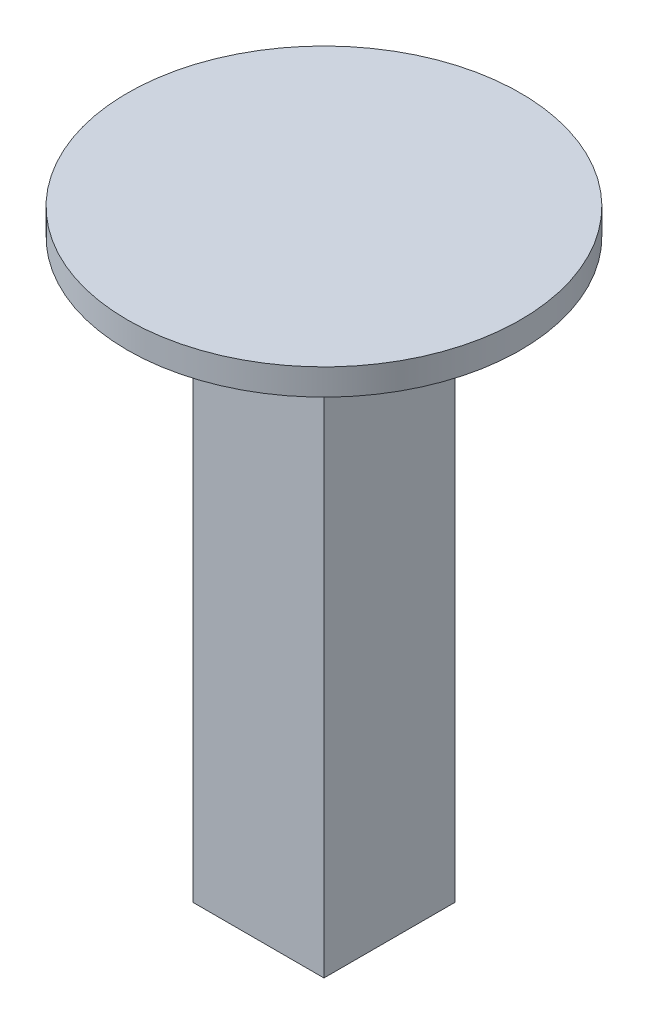
from build123d import *

# Parameters (mm, degrees)
SKETCH1_W           = 50
SKETCH1_H           = 50
BOSS_EXTRUDE1_DEPTH = 50
SKETCH4_W           = 50
SKETCH4_H           = 130
BOSS_EXTRUDE2_DEPTH = 5
SKETCH3_W           = 50
SKETCH3_H           = 130
BOSS_EXTRUDE3_DEPTH = 5
SKETCH2_W           = 50
SKETCH2_H           = 130
BOSS_EXTRUDE4_DEPTH = 5
SKETCH5_W           = 50
SKETCH5_H           = 130
BOSS_EXTRUDE5_DEPTH = 5
SKETCH6_W           = 50
SKETCH6_H           = 50
BOSS_EXTRUDE6_DEPTH = 50
SKETCH10_R          = 75
BOSS_EXTRUDE7_DEPTH = 10
SKETCH11_R          = 4
CUT_EXTRUDE1_DEPTH  = 22


with BuildPart() as part:
    # Sketch1 → Boss-Extrude1 (new body)
    with BuildSketch(Plane(origin=(0, 0, 0), x_dir=(1, 0, 0), z_dir=(0, 1, 0))):
        Rectangle(SKETCH1_W, SKETCH1_H)
    extrude(amount=BOSS_EXTRUDE1_DEPTH)

    # Sketch4 → Boss-Extrude2 (add)
    with BuildSketch(Plane(origin=(0, 0, -25), x_dir=(-1, 0, 0), z_dir=(0, 0, -1))):
        with Locations((0, 115)):
            Rectangle(SKETCH4_W, SKETCH4_H)
    extrude(amount=-BOSS_EXTRUDE2_DEPTH)

    # Sketch3 → Boss-Extrude3 (add)
    with BuildSketch(Plane(origin=(25, 0, 0), x_dir=(0, 0, -1), z_dir=(1, 0, 0))):
        with Locations((0, 115)):
            Rectangle(SKETCH3_W, SKETCH3_H)
    extrude(amount=-BOSS_EXTRUDE3_DEPTH)

    # Sketch2 → Boss-Extrude4 (add)
    with BuildSketch(Plane.XY.offset(25)):
        with Locations((0, 115)):
            Rectangle(SKETCH2_W, SKETCH2_H)
    extrude(amount=-BOSS_EXTRUDE4_DEPTH)

    # Sketch5 → Boss-Extrude5 (add)
    with BuildSketch(Plane.ZY.offset(25)):
        with Locations((0, 115)):
            Rectangle(SKETCH5_W, SKETCH5_H)
    extrude(amount=-BOSS_EXTRUDE5_DEPTH)

    # Sketch6 → Boss-Extrude6 (add)
    with BuildSketch(Plane(origin=(0, 180, 0), x_dir=(1, 0, 0), z_dir=(0, 1, 0))):
        Rectangle(SKETCH6_W, SKETCH6_H)
    extrude(amount=BOSS_EXTRUDE6_DEPTH)

    # Sketch10 → Boss-Extrude7 (add)
    with BuildSketch(Plane(origin=(0, 230, 0), x_dir=(1, 0, 0), z_dir=(0, 1, 0))):
        Circle(SKETCH10_R)
    extrude(amount=-BOSS_EXTRUDE7_DEPTH)

    # Sketch11 → Cut-Extrude1 (cut)
    with BuildSketch(Plane.XZ):
        Circle(SKETCH11_R)
    extrude(amount=-CUT_EXTRUDE1_DEPTH, mode=Mode.SUBTRACT)


solid = part.part
